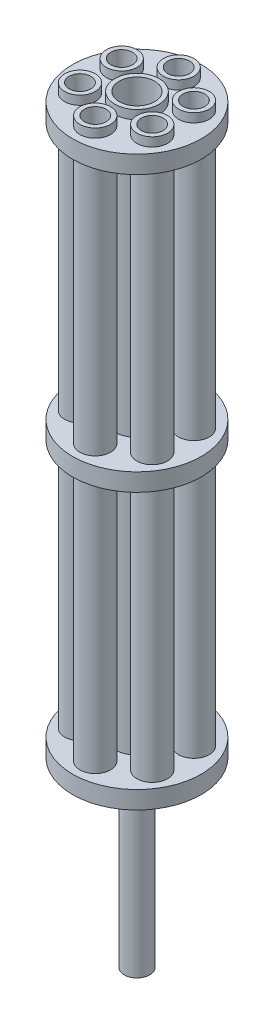
from build123d import *

# Parameters (mm, degrees)
SKETCH1_R                = 14.5
BOSS_EXTRUDE1_DEPTH      = 4
BOSS_EXTRUDE2_DEPTH      = 2
BOSS_EXTRUDE2_DEPTH_BACK = 125
SKETCH2_R                = 5
SKETCH2_R_2              = 4
SKETCH2_R_3              = 3.453892414
SKETCH2_R_4              = 2.453892414
LPATTERN4_START          = -124
LPATTERN4_OUTLINE_R      = 14.5
LPATTERN4_DEPTH          = 4
LPATTERN4_START_2        = -62
LPATTERN4_2_OUTLINE_R    = 14.5
LPATTERN4_2_OUTLINE_R_2  = 3.453892414
LPATTERN4_2_OUTLINE_R_3  = 5
LPATTERN4_2_OUTLINE_R_4  = 4
LPATTERN4_2_OUTLINE_R_5  = 2.453892414
LPATTERN4_2_DEPTH        = 4
SKETCH8_R                = 2.453892414
CUT_EXTRUDE4_DEPTH       = 128
SKETCH12_R               = 2.875
BOSS_EXTRUDE4_DEPTH      = 41
CUT_EXTRUDE5_DEPTH       = 41
SKETCH14_R               = 4
CUT_EXTRUDE6_DEPTH       = 124


# Read off the part's stored shape, not the designer's step: LPattern4
with BuildPart() as part:
    # Sketch1 → Boss-Extrude1 (new body)
    with BuildSketch(Plane(origin=(0, 0, 0), x_dir=(1, 0, 0), z_dir=(0, 1, 0))):
        with Locations(Location((0, 0, 0), (0, 0, 270))):
            Circle(SKETCH1_R)
    extrude(amount=BOSS_EXTRUDE1_DEPTH)

    # Sketch2 → Boss-Extrude2 (add, two sides: drawn at the far end of the back side and taken through both)
    # profile 1 of 7: a face of its own
    with BuildSketch(Plane(origin=(0, 4, 0), x_dir=(1, 0, 0), z_dir=(0, 1, 0)).offset(-BOSS_EXTRUDE2_DEPTH_BACK)):
        with Locations(Location((0, 0, 0), (0, 0, 270))):
            Circle(SKETCH2_R)
        with Locations(Location((0, 0, 0), (0, 0, 270))):
            Circle(SKETCH2_R_2, mode=Mode.SUBTRACT)
    # profile 2 of 7: a face of its own
    with BuildSketch(Plane(origin=(0, 4, 0), x_dir=(1, 0, 0), z_dir=(0, 1, 0)).offset(-BOSS_EXTRUDE2_DEPTH_BACK)):
        with Locations(Location((0, 9.4, 0), (0, 0, 270))):
            Circle(SKETCH2_R_3)
        with Locations(Location((0, 9.4, 0), (0, 0, 270))):
            Circle(SKETCH2_R_4, mode=Mode.SUBTRACT)
    # profile 3 of 7: a face of its own
    with BuildSketch(Plane(origin=(0, 4, 0), x_dir=(1, 0, 0), z_dir=(0, 1, 0)).offset(-BOSS_EXTRUDE2_DEPTH_BACK)):
        with Locations(Location((8.140638796, 4.7, 0), (0, 0, 270))):
            Circle(SKETCH2_R_3)
        with Locations(Location((8.140638796, 4.7, 0), (0, 0, 270))):
            Circle(SKETCH2_R_4, mode=Mode.SUBTRACT)
    # profile 4 of 7: a face of its own
    with BuildSketch(Plane(origin=(0, 4, 0), x_dir=(1, 0, 0), z_dir=(0, 1, 0)).offset(-BOSS_EXTRUDE2_DEPTH_BACK)):
        with Locations(Location((8.140638796, -4.7, 0), (0, 0, 270))):
            Circle(SKETCH2_R_3)
        with Locations(Location((8.140638796, -4.7, 0), (0, 0, 270))):
            Circle(SKETCH2_R_4, mode=Mode.SUBTRACT)
    # profile 5 of 7: a face of its own
    with BuildSketch(Plane(origin=(0, 4, 0), x_dir=(1, 0, 0), z_dir=(0, 1, 0)).offset(-BOSS_EXTRUDE2_DEPTH_BACK)):
        with Locations(Location((0, -9.4, 0), (0, 0, 270))):
            Circle(SKETCH2_R_3)
        with Locations(Location((0, -9.4, 0), (0, 0, 270))):
            Circle(SKETCH2_R_4, mode=Mode.SUBTRACT)
    # profile 6 of 7: a face of its own
    with BuildSketch(Plane(origin=(0, 4, 0), x_dir=(1, 0, 0), z_dir=(0, 1, 0)).offset(-BOSS_EXTRUDE2_DEPTH_BACK)):
        with Locations(Location((-8.140638796, -4.7, 0), (0, 0, 270))):
            Circle(SKETCH2_R_3)
        with Locations(Location((-8.140638796, -4.7, 0), (0, 0, 270))):
            Circle(SKETCH2_R_4, mode=Mode.SUBTRACT)
    # profile 7 of 7: a face of its own
    with BuildSketch(Plane(origin=(0, 4, 0), x_dir=(1, 0, 0), z_dir=(0, 1, 0)).offset(-BOSS_EXTRUDE2_DEPTH_BACK)):
        with Locations(Location((-8.140638796, 4.7, 0), (0, 0, 270))):
            Circle(SKETCH2_R_3)
        with Locations(Location((-8.140638796, 4.7, 0), (0, 0, 270))):
            Circle(SKETCH2_R_4, mode=Mode.SUBTRACT)
    extrude(amount=BOSS_EXTRUDE2_DEPTH + BOSS_EXTRUDE2_DEPTH_BACK)

    # LPattern4 outline → LPattern4 (add)
    with BuildSketch(Plane(origin=(0, 0, 0), x_dir=(1, 0, 0), z_dir=(0, 1, 0)).offset(LPATTERN4_START)):
        Circle(LPATTERN4_OUTLINE_R)
    extrude(amount=LPATTERN4_DEPTH)

    # LPattern4 2 outline → LPattern4 2 (add)
    # profile 1 of 8: a face of its own
    with BuildSketch(Plane(origin=(0, 0, 0), x_dir=(1, 0, 0), z_dir=(0, 1, 0)).offset(LPATTERN4_START_2)):
        Circle(LPATTERN4_2_OUTLINE_R)
        with Locations((-8.140638796, -4.7)):
            Circle(LPATTERN4_2_OUTLINE_R_2, mode=Mode.SUBTRACT)
        with Locations((0, -9.4)):
            Circle(LPATTERN4_2_OUTLINE_R_2, mode=Mode.SUBTRACT)
        with Locations((8.140638796, -4.7)):
            Circle(LPATTERN4_2_OUTLINE_R_2, mode=Mode.SUBTRACT)
        with Locations((-8.140638796, 4.7)):
            Circle(LPATTERN4_2_OUTLINE_R_2, mode=Mode.SUBTRACT)
        Circle(LPATTERN4_2_OUTLINE_R_3, mode=Mode.SUBTRACT)
        with Locations((8.140638796, 4.7)):
            Circle(LPATTERN4_2_OUTLINE_R_2, mode=Mode.SUBTRACT)
        with Locations((0, 9.4)):
            Circle(LPATTERN4_2_OUTLINE_R_2, mode=Mode.SUBTRACT)
    # profile 2 of 8: a face of its own
    with BuildSketch(Plane(origin=(0, 0, 0), x_dir=(1, 0, 0), z_dir=(0, 1, 0)).offset(LPATTERN4_START_2)):
        Circle(LPATTERN4_2_OUTLINE_R_4)
    # profile 3 of 8: a face of its own
    with BuildSketch(Plane(origin=(0, 0, 0), x_dir=(1, 0, 0), z_dir=(0, 1, 0)).offset(LPATTERN4_START_2)):
        with Locations((0, 9.4)):
            Circle(LPATTERN4_2_OUTLINE_R_5)
    # profile 4 of 8: a face of its own
    with BuildSketch(Plane(origin=(0, 0, 0), x_dir=(1, 0, 0), z_dir=(0, 1, 0)).offset(LPATTERN4_START_2)):
        with Locations((8.140638796, 4.7)):
            Circle(LPATTERN4_2_OUTLINE_R_5)
    # profile 5 of 8: a face of its own
    with BuildSketch(Plane(origin=(0, 0, 0), x_dir=(1, 0, 0), z_dir=(0, 1, 0)).offset(LPATTERN4_START_2)):
        with Locations((8.140638796, -4.7)):
            Circle(LPATTERN4_2_OUTLINE_R_5)
    # profile 6 of 8: a face of its own
    with BuildSketch(Plane(origin=(0, 0, 0), x_dir=(1, 0, 0), z_dir=(0, 1, 0)).offset(LPATTERN4_START_2)):
        with Locations((0, -9.4)):
            Circle(LPATTERN4_2_OUTLINE_R_5)
    # profile 7 of 8: a face of its own
    with BuildSketch(Plane(origin=(0, 0, 0), x_dir=(1, 0, 0), z_dir=(0, 1, 0)).offset(LPATTERN4_START_2)):
        with Locations((-8.140638796, -4.7)):
            Circle(LPATTERN4_2_OUTLINE_R_5)
    # profile 8 of 8: a face of its own
    with BuildSketch(Plane(origin=(0, 0, 0), x_dir=(1, 0, 0), z_dir=(0, 1, 0)).offset(LPATTERN4_START_2)):
        with Locations((-8.140638796, 4.7)):
            Circle(LPATTERN4_2_OUTLINE_R_5)
    extrude(amount=LPATTERN4_2_DEPTH)

    # Sketch8 → Cut-Extrude4 (cut)
    with BuildSketch(Plane(origin=(0, 4, 0), x_dir=(1, 0, 0), z_dir=(0, 1, 0))):
        with Locations(Location((-8.140638796, -4.7, 0), (0, 0, 270))):
            Circle(SKETCH8_R)
        with Locations(Location((0, -9.4, 0), (0, 0, 270))):
            Circle(SKETCH8_R)
        with Locations(Location((8.140638796, -4.7, 0), (0, 0, 270))):
            Circle(SKETCH8_R)
        with Locations(Location((8.140638796, 4.7, 0), (0, 0, 270))):
            Circle(SKETCH8_R)
        with Locations(Location((0, 9.4, 0), (0, 0, 270))):
            Circle(SKETCH8_R)
        with Locations(Location((-8.140638796, 4.7, 0), (0, 0, 270))):
            Circle(SKETCH8_R)
    extrude(amount=-CUT_EXTRUDE4_DEPTH, mode=Mode.SUBTRACT)

    # Sketch12 → Boss-Extrude4 (add)
    with BuildSketch(Plane.XZ.offset(124)):
        with Locations(Location((0, 0, 0), (0, 0, 90))):
            Circle(SKETCH12_R)
    extrude(amount=BOSS_EXTRUDE4_DEPTH)

    # Sketch9 → Cut-Extrude5 (cut)
    with BuildSketch(Plane.XZ.offset(165)):
        with BuildLine():
            Line((1.5, 1.469693846), (1.5, -1.469693846))
            ThreePointArc((1.5, -1.469693846), (-2.1, 0), (1.5, 1.469693846))
        make_face()
    extrude(amount=-CUT_EXTRUDE5_DEPTH, mode=Mode.SUBTRACT)

    # Sketch14 → Cut-Extrude6 (cut)
    with BuildSketch(Plane(origin=(0, 4, 0), x_dir=(1, 0, 0), z_dir=(0, 1, 0))):
        with Locations(Location((0, 0, 0), (0, 0, 270))):
            Circle(SKETCH14_R)
    extrude(amount=-CUT_EXTRUDE6_DEPTH, mode=Mode.SUBTRACT)


solid = part.part
